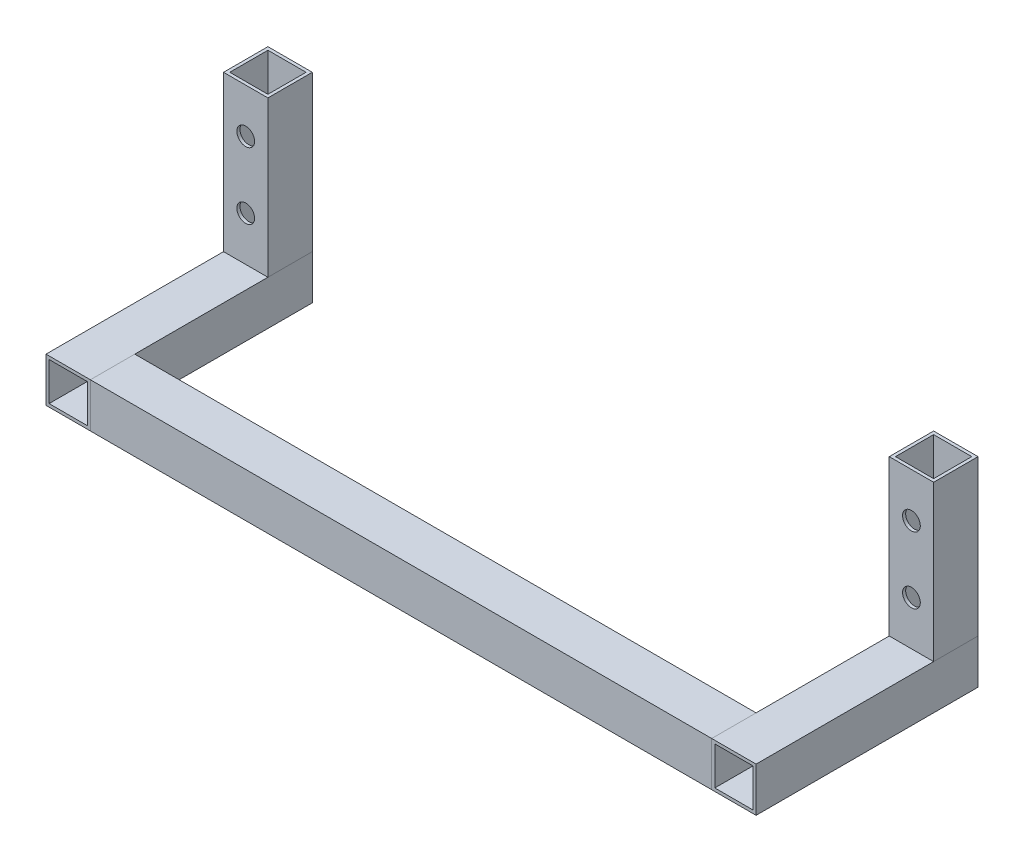
from build123d import *

# Parameters (mm, degrees)
SKETCH_11_ON_SEGMENT_1_W   = 10
SKETCH_11_ON_SEGMENT_1_H   = 10
SKETCH_11_ON_SEGMENT_1_W_2 = 8.6
SKETCH_11_ON_SEGMENT_1_H_2 = 8.6
F_10X10X0_7_1_DEPTH        = 48.071067812
SKETCH_11_ON_SEGMENT_2_W   = 10
SKETCH_11_ON_SEGMENT_2_H   = 10
SKETCH_11_ON_SEGMENT_2_W_2 = 8.6
SKETCH_11_ON_SEGMENT_2_H_2 = 8.6
F_10X10X0_7_1_2_DEPTH      = 166.142135624
F_10X10X0_7_1_3_DEPTH      = 40
F_10X10X0_7_1_3_DEPTH_BACK = 8.071067812
SKETCH_11_W                = 10
SKETCH_11_H                = 10
SKETCH_11_W_2              = 8.6
SKETCH_11_H_2              = 8.6
SKETCH_14_W                = 10
SKETCH_14_H                = 10
SKETCH_14_W_2              = 8.6
SKETCH_14_H_2              = 8.6
F_10X10X0_7_5_DEPTH        = 45
SKETCH_14_ON_SEGMENT_2_W   = 10
SKETCH_14_ON_SEGMENT_2_H   = 10
SKETCH_14_ON_SEGMENT_2_W_2 = 8.6
SKETCH_14_ON_SEGMENT_2_H_2 = 8.6
F_10X10X0_7_5_2_DEPTH      = 45
PART_START                 = 22.5
PART_RUN_ON_DEPTH          = 27.5
BODY_START                 = 17.5
BODY_3_RUN_ON_DEPTH        = 27.5
WELD_START                 = -5
WELD_TRIM_4_DEPTH          = 10
WELD_TRIM_4_2_DEPTH        = 0.7
WELD_START_2               = 4.3
WELD_TRIM_4_3_DEPTH        = 0.7
WELD_START_3               = 70
WELD_TRIM_4_4_OUTLINE_W    = 12
WELD_TRIM_4_4_OUTLINE_H    = 14
WELD_TRIM_4_4_DEPTH        = 10
WELD_START_4               = -80
WELD_TRIM_5_OUTLINE_W      = 12
WELD_TRIM_5_OUTLINE_H      = 13
WELD_TRIM_5_DEPTH          = 10
WELD_TRIM_5_2_DEPTH        = 10
WELD_TRIM_5_3_DEPTH        = 0.7
WELD_TRIM_5_4_DEPTH        = 0.7
SKETCH_15_R                = 2
CUT_EXTRUDE_1_DEPTH        = 10


# Read off the part's stored shape, not the designer's step: 剪裁/延伸4, 剪裁/延伸5
with BuildPart() as part:
    # 草图11 on segment 1 (carried to segment 1) → 常用材料 不锈钢10X10X0.7(1) (new body)
    with BuildSketch(Plane(origin=(75, 0, -40), x_dir=(1, 0, 0), z_dir=(0, 0, 1))):
        Rectangle(SKETCH_11_ON_SEGMENT_1_W, SKETCH_11_ON_SEGMENT_1_H)
        Rectangle(SKETCH_11_ON_SEGMENT_1_W_2, SKETCH_11_ON_SEGMENT_1_H_2, mode=Mode.SUBTRACT)
    extrude(amount=F_10X10X0_7_1_DEPTH)

    # 常用材料 不锈钢10X10X0.7(1) mitre 1
    split(bisect_by=Plane(origin=(75, 0, 0), x_dir=(0, 1, 0), z_dir=(0.707106781, 0, -0.707106781)), keep=Keep.TOP)

    # part cut square before the run-on
    split(bisect_by=Plane(origin=(75, 0, -17.5), x_dir=(0, -1, 0), z_dir=(0, 0, 1)), keep=Keep.TOP)

    # 草图11 on segment 1 (carried to segment 1) → part run on (add)
    with BuildSketch(Plane(origin=(75, 0, -40), x_dir=(1, 0, 0), z_dir=(0, 0, 1)).offset(PART_START)):
        Rectangle(SKETCH_11_ON_SEGMENT_1_W, SKETCH_11_ON_SEGMENT_1_H)
        Rectangle(SKETCH_11_ON_SEGMENT_1_W_2, SKETCH_11_ON_SEGMENT_1_H_2, mode=Mode.SUBTRACT)
    extrude(amount=-PART_RUN_ON_DEPTH)

    # Weld Trim 4 outline → Weld Trim 4 (add)
    with BuildSketch(Plane(origin=(0, 0, 0), x_dir=(1, 0, 0), z_dir=(0, 1, 0)).offset(WELD_START)):
        Polygon((70, 5), (70, -5), (70.7, -5), (70.7, 4.3), align=None)
        Polygon((79.3, -4.3), (79.3, -5), (80, -5), align=None)
    extrude(amount=WELD_TRIM_4_DEPTH)

    # Weld Trim 4 2 outline → Weld Trim 4 2 (add)
    with BuildSketch(Plane(origin=(0, 0, 0), x_dir=(1, 0, 0), z_dir=(0, 1, 0)).offset(WELD_START)):
        Polygon((70.7, 4.3), (70.7, -5), (79.3, -5), (79.3, -4.3), align=None)
    extrude(amount=WELD_TRIM_4_2_DEPTH)

    # Weld Trim 4 3 outline → Weld Trim 4 3 (add)
    with BuildSketch(Plane(origin=(0, 0, 0), x_dir=(1, 0, 0), z_dir=(0, 1, 0)).offset(WELD_START_2)):
        Polygon((70.7, 4.3), (70.7, -5), (79.3, -5), (79.3, -4.3), align=None)
    extrude(amount=WELD_TRIM_4_3_DEPTH)


with BuildPart() as body_2:
    # 草图11 on segment 2 (carried to segment 2) → 10X10X0.7_1 2 (new body)
    with BuildSketch(Plane.ZY.offset(-83.071067812)):
        Rectangle(SKETCH_11_ON_SEGMENT_2_W, SKETCH_11_ON_SEGMENT_2_H)
        Rectangle(SKETCH_11_ON_SEGMENT_2_W_2, SKETCH_11_ON_SEGMENT_2_H_2, mode=Mode.SUBTRACT)
    extrude(amount=F_10X10X0_7_1_2_DEPTH)

    # 10X10X0.7_1 2 mitre 1
    split(bisect_by=Plane(origin=(75, 0, 0), x_dir=(0, -1, 0), z_dir=(-0.707106781, 0, 0.707106781)), keep=Keep.TOP)

    # 10X10X0.7_1 2 mitre 2
    split(bisect_by=Plane(origin=(-75, 0, 0), x_dir=(0, 1, 0), z_dir=(0.707106781, 0, 0.707106781)), keep=Keep.TOP)

    # Weld Trim 4 4 outline → Weld Trim 4 4 (cut)
    with BuildSketch(Plane.YZ.offset(WELD_START_3)):
        Rectangle(WELD_TRIM_4_4_OUTLINE_W, WELD_TRIM_4_4_OUTLINE_H)
    extrude(amount=WELD_TRIM_4_4_DEPTH, mode=Mode.SUBTRACT)

    # Weld Trim 5 outline → Weld Trim 5 (cut)
    with BuildSketch(Plane.YZ.offset(WELD_START_4)):
        with Locations((0, 0.5)):
            Rectangle(WELD_TRIM_5_OUTLINE_W, WELD_TRIM_5_OUTLINE_H)
    extrude(amount=WELD_TRIM_5_DEPTH, mode=Mode.SUBTRACT)


with BuildPart() as body_3:
    # 草图11 → 10X10X0.7_1 3 (new, two sides: drawn at the far end of the back side and taken through both)
    with BuildSketch(Plane(origin=(-75, 0, 0), x_dir=(-1, 0, 0), z_dir=(0, 0, -1)).offset(-F_10X10X0_7_1_3_DEPTH_BACK)):
        Rectangle(SKETCH_11_W, SKETCH_11_H)
        Rectangle(SKETCH_11_W_2, SKETCH_11_H_2, mode=Mode.SUBTRACT)
    extrude(amount=F_10X10X0_7_1_3_DEPTH + F_10X10X0_7_1_3_DEPTH_BACK)

    # 10X10X0.7_1 3 mitre 1
    split(bisect_by=Plane(origin=(-75, 0, 0), x_dir=(0, -1, 0), z_dir=(-0.707106781, 0, -0.707106781)), keep=Keep.TOP)

    # body 3 cut square before the run-on
    split(bisect_by=Plane(origin=(-75, 0, -17.5), x_dir=(0, -1, 0), z_dir=(0, 0, 1)), keep=Keep.TOP)

    # 草图11 → body 3 run on (add)
    with BuildSketch(Plane(origin=(-75, 0, 0), x_dir=(-1, 0, 0), z_dir=(0, 0, -1)).offset(BODY_START)):
        Rectangle(SKETCH_11_W, SKETCH_11_H)
        Rectangle(SKETCH_11_W_2, SKETCH_11_H_2, mode=Mode.SUBTRACT)
    extrude(amount=BODY_3_RUN_ON_DEPTH)

    # Weld Trim 5 2 outline → Weld Trim 5 2 (add)
    with BuildSketch(Plane(origin=(0, 0, 0), x_dir=(1, 0, 0), z_dir=(0, 1, 0)).offset(WELD_START)):
        Polygon((-70, -5), (-70, 5), (-70.7, 4.3), (-70.7, -5), align=None)
        Polygon((-79.3, -5), (-79.3, -4.3), (-80, -5), align=None)
    extrude(amount=WELD_TRIM_5_2_DEPTH)

    # Weld Trim 5 3 outline → Weld Trim 5 3 (add)
    with BuildSketch(Plane(origin=(0, 0, 0), x_dir=(1, 0, 0), z_dir=(0, 1, 0)).offset(WELD_START)):
        Polygon((-70.7, -5), (-70.7, 4.3), (-79.3, -4.3), (-79.3, -5), align=None)
    extrude(amount=WELD_TRIM_5_3_DEPTH)

    # Weld Trim 5 4 outline → Weld Trim 5 4 (add)
    with BuildSketch(Plane(origin=(0, 0, 0), x_dir=(1, 0, 0), z_dir=(0, 1, 0)).offset(WELD_START_2)):
        Polygon((-70.7, -5), (-70.7, 4.3), (-79.3, -4.3), (-79.3, -5), align=None)
    extrude(amount=WELD_TRIM_5_4_DEPTH)


with BuildPart() as body_4:
    # 草图14 → 常用材料 不锈钢10X10X0.7(5) (new body)
    with BuildSketch(Plane(origin=(75, -5, -40), x_dir=(1, 0, 0), z_dir=(0, 1, 0))):
        Rectangle(SKETCH_14_W, SKETCH_14_H)
        Rectangle(SKETCH_14_W_2, SKETCH_14_H_2, mode=Mode.SUBTRACT)
    extrude(amount=F_10X10X0_7_5_DEPTH)

    # Weld Trim 1 3
    split(bisect_by=Plane(origin=(75.208333333, 5, -19.895833333), x_dir=(-1, 0, 0), z_dir=(0, 1, 0)), keep=Keep.TOP)


with BuildPart() as body_5:
    # 草图14 on segment 2 (carried to segment 2) → 10X10X0.7_5 2 (new body)
    with BuildSketch(Plane(origin=(-75, -5, -40), x_dir=(1, 0, 0), z_dir=(0, 1, 0))):
        Rectangle(SKETCH_14_ON_SEGMENT_2_W, SKETCH_14_ON_SEGMENT_2_H)
        Rectangle(SKETCH_14_ON_SEGMENT_2_W_2, SKETCH_14_ON_SEGMENT_2_H_2, mode=Mode.SUBTRACT)
    extrude(amount=F_10X10X0_7_5_2_DEPTH)

    # Weld Trim 2 3
    split(bisect_by=Plane(origin=(-75.208333333, 5, -19.895833333), x_dir=(-1, 0, 0), z_dir=(0, 1, 0)), keep=Keep.TOP)


with BuildPart() as cut_extrude_1_tool:
    # 草图15 → 切除-拉伸1 (new body)
    with BuildSketch(Plane(origin=(0, 0, -45), x_dir=(-1, 0, 0), z_dir=(0, 0, -1))):
        with Locations((-75, 30)):
            Circle(SKETCH_15_R)
        with Locations((-75, 15)):
            Circle(SKETCH_15_R)
        with Locations(Location((75, 30, 0), (0, 0, 180))):
            Circle(SKETCH_15_R)
        with Locations(Location((75, 15, 0), (0, 0, 180))):
            Circle(SKETCH_15_R)
    extrude(amount=-CUT_EXTRUDE_1_DEPTH)


with BuildPart() as body_4_1:
    add(body_4.part)

    # 切除-拉伸1: cut by cut_extrude_1_tool
    add(cut_extrude_1_tool.part, mode=Mode.SUBTRACT)


with BuildPart() as body_5_1:
    add(body_5.part)

    # 切除-拉伸1: cut by cut_extrude_1_tool
    add(cut_extrude_1_tool.part, mode=Mode.SUBTRACT)


solid = Compound([part.part, body_2.part, body_3.part, body_4_1.part, body_5_1.part])
